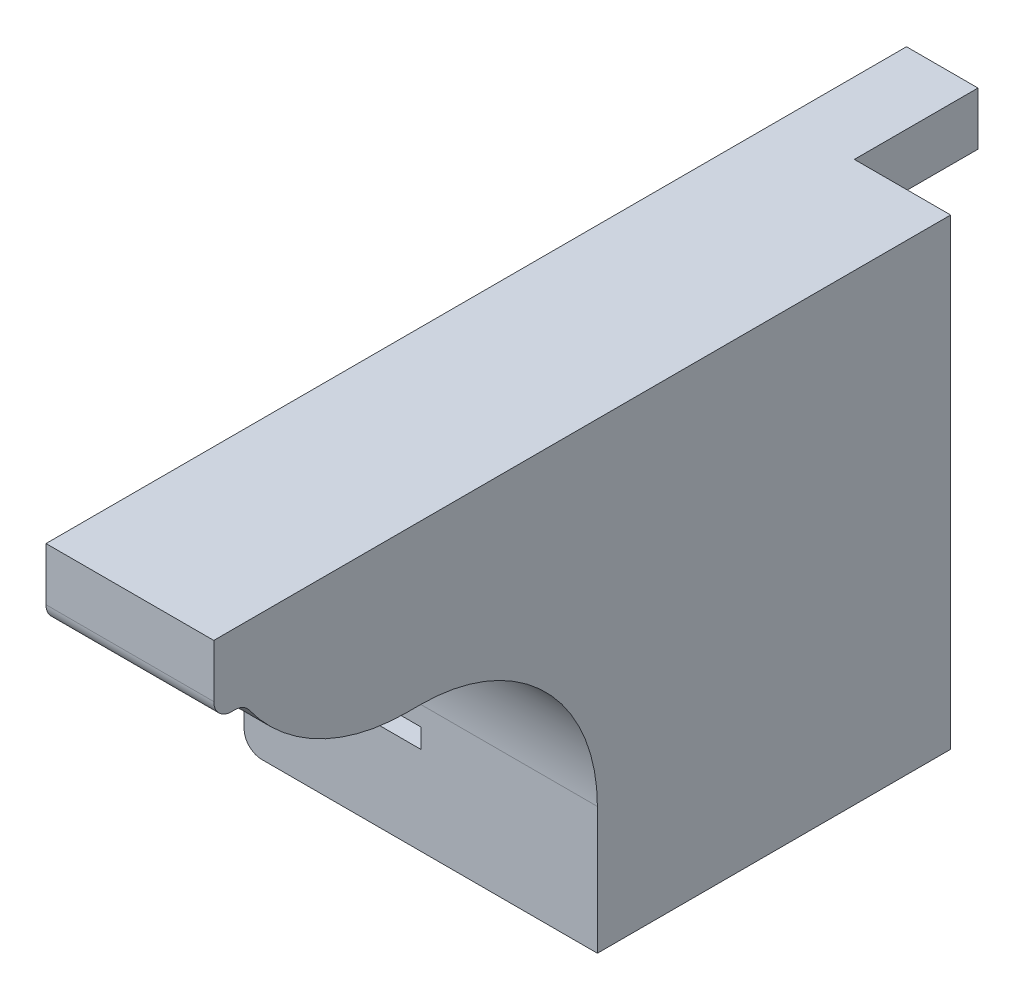
from build123d import *

# Parameters (mm, degrees)
BOSS_EXTRU_1_DEPTH = 10
ESQUISSE2_W        = 9.5
ESQUISSE2_H        = 22.2
BOSS_EXTRU_2_DEPTH = 10
ESQUISSE3_W        = 10
ESQUISSE3_H        = 5
BOSS_EXTRU_3_DEPTH = 20
CONG_1_R           = 10
CHANFREIN1_SIZE    = 4
CONG_3_R           = 1
ESQUISSE5_W        = 9.5
ESQUISSE5_H        = 4.718482058
BOSS_EXTRU_5_DEPTH = 4
ESQUISSE6_W        = 4.048947881
ESQUISSE6_H        = 3
BOSS_EXTRU_6_DEPTH = 7
ESQUISSE7_W        = 9.5
ESQUISSE7_H        = 4
BOSS_EXTRU_7_DEPTH = 37
CONG_4_R           = 11
CONG_6_R           = 1


with BuildPart() as part:
    # Esquisse1 → Boss.-Extru.1 (new body)
    with BuildSketch(Plane.XY):
        Polygon((0, 0), (10, 0), (10, -22.2), (-10, -22.2), (-10, -17.2), (0, -17.2), (0, -16.1), (-10, -16.1), (-10, -11.1), (0, -11.1), (0, -10), (-10, -10), (-10, -5), (0, -5), align=None)
    extrude(amount=BOSS_EXTRU_1_DEPTH)

    # Esquisse2 → Boss.-Extru.2 (add)
    with BuildSketch(Plane(origin=(0, 0, 0), x_dir=(-1, 0, 0), z_dir=(0, 0, -1))):
        with Locations((-5.25, -11.1)):
            Rectangle(ESQUISSE2_W, ESQUISSE2_H)
    extrude(amount=BOSS_EXTRU_2_DEPTH)

    # Esquisse3 → Boss.-Extru.3 (add)
    with BuildSketch(Plane.XY.offset(10)):
        with Locations((5, -2.5)):
            Rectangle(ESQUISSE3_W, ESQUISSE3_H)
    extrude(amount=BOSS_EXTRU_3_DEPTH)

    # Congé1
    # the kernel refuses this fillet: 10 mm, written as the material it adds along each edge
    with BuildSketch(Plane(origin=(0, -5, 10), x_dir=(0, -1, 0), z_dir=(1, 0, 0))) as cong_1_piece_1:
        with BuildLine():
            CenterArc((CONG_1_R, -CONG_1_R), CONG_1_R, 90, 90)
            Line((0, -CONG_1_R), (0, 0))
            Line((0, 0), (CONG_1_R, 0))
        make_face()
    extrude(amount=10)

    # Chanfrein1
    chanfrein1_edges = [part.edges().sort_by_distance(p)[0] for p in [
        (-10, -5, 5),
    ]]
    chamfer(chanfrein1_edges, length=CHANFREIN1_SIZE)

    # Congé3
    # the kernel refuses this fillet: 1 mm, written as the material it takes off along each edge
    with BuildSketch(Plane(origin=(-10, -22.2, -2.5), x_dir=(1, 0, 0), z_dir=(0, 0, 1)), Plane(origin=(-10, -17.2, -2.5), x_dir=(0, -1, 0), z_dir=(0, 0, 1))) as cong_3_piece_1:
        with BuildLine():
            CenterArc((CONG_3_R, CONG_3_R), CONG_3_R, 180, 90)
            Line((0, CONG_3_R), (0, 0))
            Line((0, 0), (CONG_3_R, 0))
        make_face()
    extrude(amount=15, mode=Mode.SUBTRACT)
    with BuildSketch(Plane(origin=(-10, -16.1, -2.5), x_dir=(0, 1, 0), z_dir=(0, 0, 1)), Plane(origin=(-10, -11.1, -2.5), x_dir=(1, 0, 0), z_dir=(0, 0, 1)), Plane(origin=(-10, -10, -2.5), x_dir=(0, 1, 0), z_dir=(0, 0, 1))) as cong_3_piece_2:
        with BuildLine():
            CenterArc((CONG_3_R, -CONG_3_R), CONG_3_R, 90, 90)
            Line((0, -CONG_3_R), (0, 0))
            Line((0, 0), (CONG_3_R, 0))
        make_face()
    extrude(amount=15, mode=Mode.SUBTRACT)
    with BuildSketch(Plane(origin=(-10, -9, -1.035533906), x_dir=(0, -1, 0), z_dir=(0, 0, 1))) as cong_3_piece_3:
        with BuildLine():
            CenterArc((CONG_3_R * 0.414213562373, CONG_3_R), CONG_3_R, 225, 45)
            Line((-CONG_3_R * 0.292893218813, CONG_3_R * 0.292893218813), (0, 0))
            Line((0, 0), (CONG_3_R * 0.414213562373, 0))
        make_face()
    extrude(amount=12.071067812, mode=Mode.SUBTRACT)

    # Esquisse5 → Boss.-Extru.5 (add)
    with BuildSketch(Plane(origin=(0, 0, 0), x_dir=(1, 0, 0), z_dir=(0, 1, 0))):
        with Locations((5.25, 7.640758971)):
            Rectangle(ESQUISSE5_W, ESQUISSE5_H)
    extrude(amount=BOSS_EXTRU_5_DEPTH)

    # Esquisse6 → Boss.-Extru.6 (add)
    with BuildSketch(Plane(origin=(0, 0, -10), x_dir=(-1, 0, 0), z_dir=(0, 0, -1))):
        with Locations((-2.524473941, 2.5)):
            Rectangle(ESQUISSE6_W, ESQUISSE6_H)
    extrude(amount=BOSS_EXTRU_6_DEPTH)

    # Esquisse7 → Boss.-Extru.7 (add)
    with BuildSketch(Plane.XY.offset(-5.281517942)):
        with Locations((5.25, 2)):
            Rectangle(ESQUISSE7_W, ESQUISSE7_H)
    extrude(amount=BOSS_EXTRU_7_DEPTH)

    # Congé4
    # the kernel refuses this fillet: 11 mm, written as the material it takes off along each edge
    with BuildSketch(Plane(origin=(-23.048861143, -5, 30), x_dir=(0, 1.0, -1.1723955140032709e-12), z_dir=(1, 0, 0))) as cong_4_piece_1:
        with BuildLine():
            CenterArc((11, -9.219544457), CONG_4_R, 123.055731151, 56.944268849)
            Line((0, -9.219544457), (-0.22, -9.219544457))
            Line((-0.22, -9.219544457), (-0.22, 0))
            Line((-0.22, 0), (0, 0.22))
            ThreePointArc((0, 0.22), (2.5, 0.22), (4.88, 0.184390889))
            Line((4.88, 0.184390889), (5, 0))
        make_face()
    extrude(amount=56.097722287, mode=Mode.SUBTRACT)

    # Congé6
    cong_6_edges = [part.edges().sort_by_distance(p)[0] for p in [
        (5.25, 0, 31.718482058),
        (5.25, 0, 30),
    ]]
    fillet(cong_6_edges, radius=CONG_6_R)


solid = part.part
